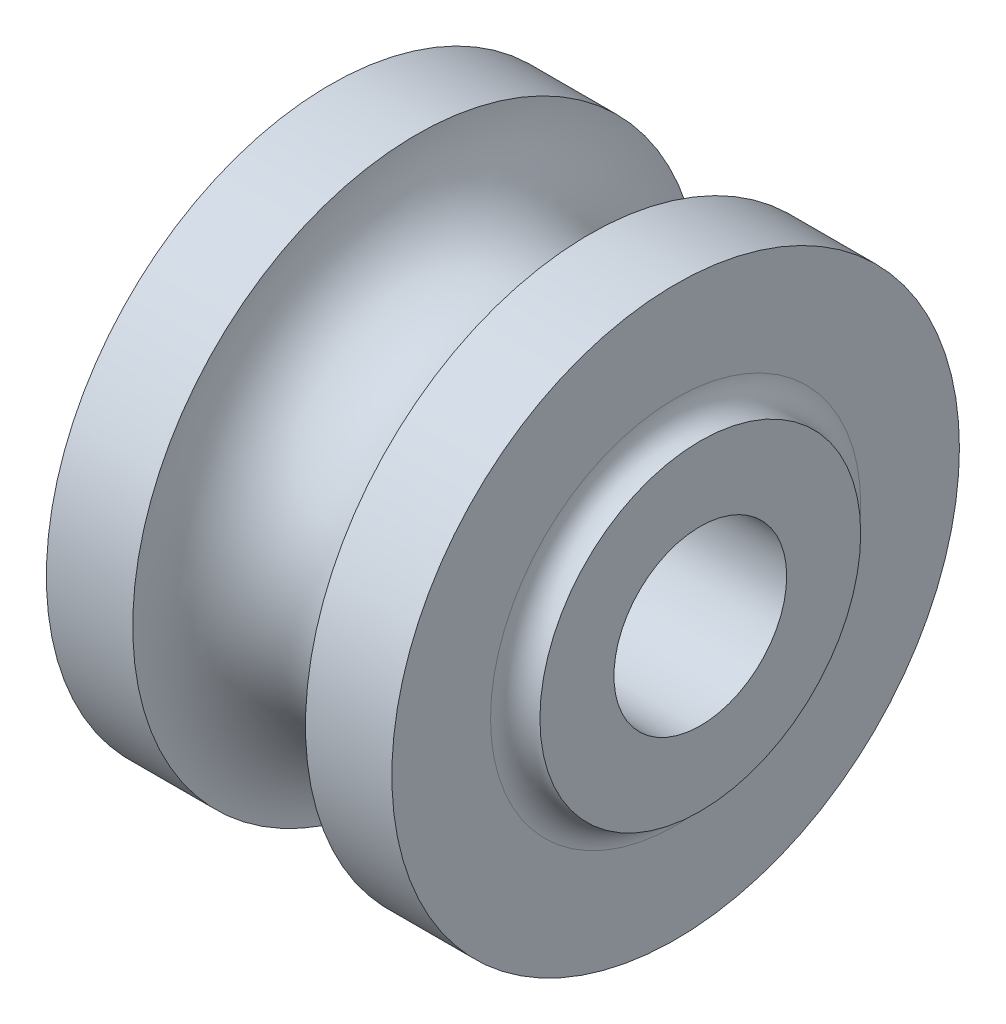
from build123d import *

# Parameters (mm, degrees)
FILLET1_R = 2


with BuildPart() as part:
    # Sketch1 → Revolve1 (revolve)
    with BuildSketch(Plane.XY, mode=Mode.PRIVATE) as revolve1_sk:
        with BuildLine():
            Line((-16, 7), (16, 7))
            Line((16, 7), (16, 13))
            Line((16, 13), (14, 13))
            Line((14, 13), (14, 23))
            Line((14, 23), (7, 23))
            ThreePointArc((7, 23), (0, 16), (-7, 23))
            Line((-7, 23), (-14, 23))
            Line((-14, 23), (-14, 13))
            Line((-14, 13), (-16, 13))
            Line((-16, 13), (-16, 7))
        make_face()
    revolve(revolve1_sk.sketch.rotate(Axis((0, 0, 0), (-1, 0, 0)), 90), axis=Axis((0, 0, 0), (-1, 0, 0)))

    # Fillet1
    fillet1_edges = [part.edges().sort_by_distance(p)[0] for p in [
        (-14, 0, 13),
        (14, 0, 13),
    ]]
    fillet(fillet1_edges, radius=FILLET1_R - 0.0001)  # a hair under: the kernel refuses the full size


solid = part.part
